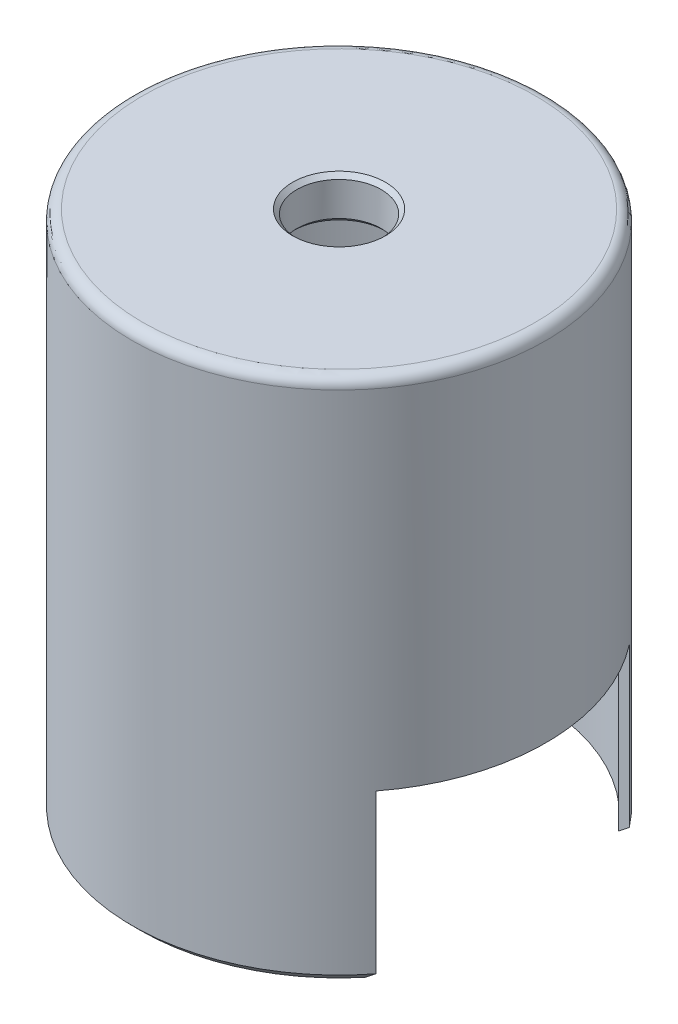
from build123d import *

# Parameters (mm, degrees)
SKETCH_1_R               = 9.8
EXTRUDE_1_DEPTH          = 25
FILLET_1_R               = 0.5
SKETCH_5_R               = 9.4
CUT_EXTRUDE_2_DEPTH      = 23
CUT_EXTRUDE_3_DEPTH      = 29.584611279
CUT_EXTRUDE_3_DEPTH_BACK = 29.584611279
SKETCH_6_W               = 12
SKETCH_6_H               = 16
CHAMFER_4_SIZE           = 0.5
SKETCH_9_R               = 2
CUT_EXTRUDE_4_DEPTH      = 29.497192879
CHAMFER_5_SIZE           = 0.2


with BuildPart() as part:
    # 草图1 → 凸台-拉伸1 (new body)
    with BuildSketch(Plane(origin=(0, 0, 0), x_dir=(1, 0, 0), z_dir=(0, 1, 0))):
        with Locations(Location((0, 0, 0), (0, 0, 270))):
            Circle(SKETCH_1_R)
    extrude(amount=EXTRUDE_1_DEPTH)

    # 圆角1
    fillet_1_edges = [part.edges().sort_by_distance(p)[0] for p in [
        (0, 25, -9.8),
    ]]
    fillet(fillet_1_edges, radius=FILLET_1_R)

    # 草图5 → 切除-拉伸2 (cut)
    with BuildSketch(Plane.XZ):
        with Locations(Location((0, 0, 0), (0, 0, 270))):
            Circle(SKETCH_5_R)
    extrude(amount=-CUT_EXTRUDE_2_DEPTH, mode=Mode.SUBTRACT)

    # 草图6 → 切除-拉伸3 (cut, two sides: drawn at the far end of the back side and taken through both)
    with BuildSketch(Plane(origin=(0, 0, 0), x_dir=(0, 0, -1), z_dir=(1, 0, 0)).offset(-CUT_EXTRUDE_3_DEPTH_BACK)):
        Rectangle(SKETCH_6_W, SKETCH_6_H)
    extrude(amount=CUT_EXTRUDE_3_DEPTH + CUT_EXTRUDE_3_DEPTH_BACK, mode=Mode.SUBTRACT)

    # 倒角4
    # the kernel refuses this chamfer: 0.5 mm, written as the material it takes off along each edge
    with BuildSketch(Plane(origin=(0, 0, 0), x_dir=(0, 0, 1), z_dir=(-1, 0, 0))) as chamfer_4_piece_1:
        Polygon((9.8, CHAMFER_4_SIZE), (9.8 - CHAMFER_4_SIZE, 0), (9.8, 0), align=None)
    revolve(axis=Axis((0, 0, 0), (0, 1, 0)), revolution_arc=59.766699, mode=Mode.SUBTRACT)
    with BuildSketch(Plane(origin=(0, 0, 0), x_dir=(0.8640091314658966, 0, -0.5034761372136191), z_dir=(0.5034761372136191, 0, 0.8640091314658966))) as chamfer_4_piece_2:
        Polygon((9.8, CHAMFER_4_SIZE), (9.8 - CHAMFER_4_SIZE, 0), (9.8, 0), align=None)
    revolve(axis=Axis((0, 0, 0), (0, 1, 0)), revolution_arc=119.539505786, mode=Mode.SUBTRACT)
    with BuildSketch(Plane(origin=(0, 0, 0), x_dir=(-0.8639822947128161, 0, 0.503522188610171), z_dir=(-0.503522188610171, 0, -0.8639822947128161))) as chamfer_4_piece_3:
        Polygon((9.8, CHAMFER_4_SIZE), (9.8 - CHAMFER_4_SIZE, 0), (9.8, 0), align=None)
    revolve(axis=Axis((0, 0, 0), (0, 1, 0)), revolution_arc=59.766699, mode=Mode.SUBTRACT)

    # 草图9 → 切除-拉伸4 (cut, through all)
    with BuildSketch(Plane(origin=(0, 25, 0), x_dir=(1, 0, 0), z_dir=(0, 1, 0))):
        with Locations(Location((0, 0, 0), (0, 0, 270))):
            Circle(SKETCH_9_R)
    extrude(amount=-CUT_EXTRUDE_4_DEPTH, mode=Mode.SUBTRACT)

    # 倒角5
    chamfer_5_edges = [part.edges().sort_by_distance(p)[0] for p in [
        (0, 23, -2),
        (0, 25, -2),
    ]]
    chamfer(chamfer_5_edges, length=CHAMFER_5_SIZE)


solid = part.part
